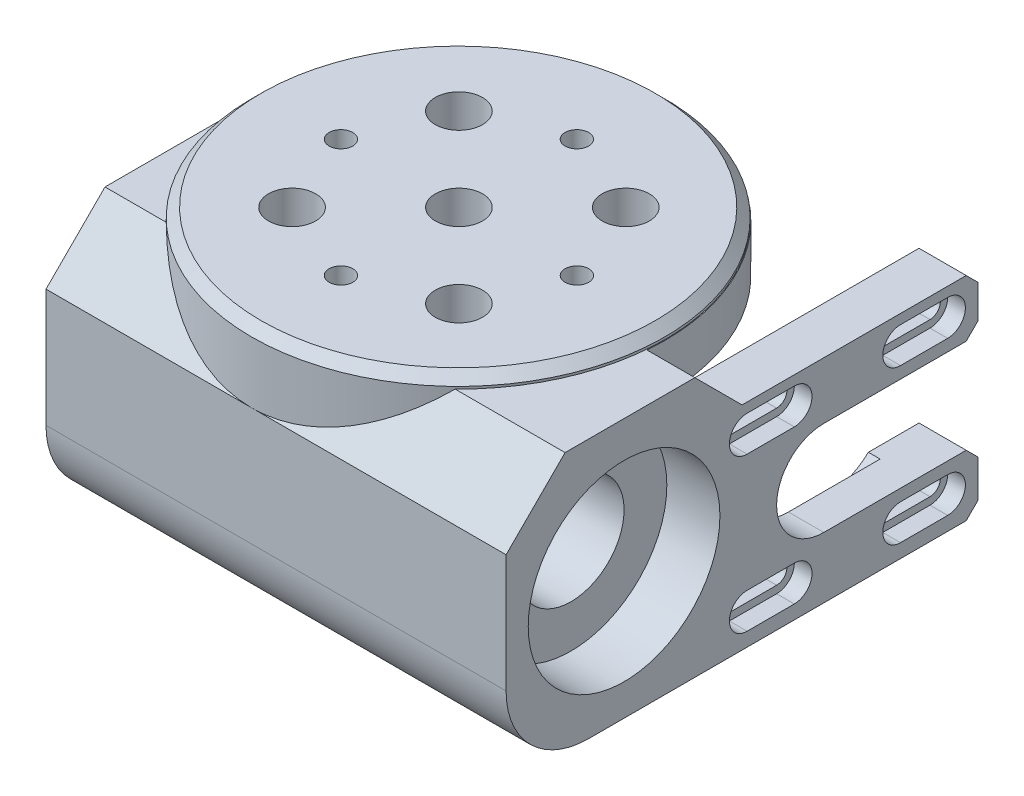
from build123d import *
from build123d.topology import SkipClean

# Parameters (mm, degrees)
SKETCH1_R           = 35.00000000000001
SKETCH1_R_2         = 4
BOSS_EXTRUDE1_DEPTH = 2
CHAMFER1_SIZE       = 1.6
BOSS_EXTRUDE2_START = 8
SKETCH2_R           = 4
BOSS_EXTRUDE2_DEPTH = 8
BOSS_EXTRUDE3_START = 36
SKETCH3_R           = 3.999999999999999
BOSS_EXTRUDE3_DEPTH = 36
BOSS_EXTRUDE4_DEPTH = 8
CUT_EXTRUDE1_DEPTH  = 8
SKETCH6_R           = 9
CUT_EXTRUDE2_DEPTH  = 101.22474744293447
SKETCH7_R           = 16.25
CUT_EXTRUDE3_DEPTH  = 9
CUT_EXTRUDE4_START  = -9
SKETCH8_R           = 16.25
CUT_EXTRUDE4_DEPTH  = 9
CHAMFER2_SIZE       = 10
FILLET1_R           = 14
FILLET2_R           = 14
CUT_EXTRUDE5_DEPTH  = 9
CUT_EXTRUDE6_DEPTH  = 9
CHAMFER3_SIZE       = 2
CUT_EXTRUDE7_START  = -3
CUT_EXTRUDE7_DEPTH  = 3
BOSS_EXTRUDE5_START = 36
BOSS_EXTRUDE5_DEPTH = 36
CHAMFER4_SIZE       = 23
CHAMFER4_SIZE2      = 35.41689416773558
SKETCH13_R          = 2.0000000000000004
CUT_EXTRUDE8_DEPTH  = 12
SKETCH14_R          = 4.000000000000001
SKETCH14_R_2        = 4.000000000000002
CUT_EXTRUDE9_DEPTH  = 7
CUT_EXTRUDE10_DEPTH = 15
SKETCH16_W          = 8
SKETCH16_H          = 8
BOSS_EXTRUDE6_DEPTH = 5
CHAMFER5_SIZE       = 8
CUT_EXTRUDE11_DEPTH = 2


with BuildPart() as part:
    # Sketch1 → Boss-Extrude1 (new body)
    with BuildSketch(Plane(origin=(0, 0, 0), x_dir=(1, 0, 0), z_dir=(0, 1, 0))):
        with Locations(Location((-0.12572339457591175, 0, 0), (0, 0, 270))):
            Circle(SKETCH1_R)
        with Locations(Location((0, 0, 0), (0, 0, 270))):
            Circle(SKETCH1_R_2, mode=Mode.SUBTRACT)
    extrude(amount=BOSS_EXTRUDE1_DEPTH)

    # Chamfer1
    chamfer1_edges = [part.edges().sort_by_distance(p)[0] for p in [
        (-0.12572339457590104, 2, -35.00000000000001),
    ]]
    chamfer(chamfer1_edges, length=CHAMFER1_SIZE)

    # Sketch2 → Boss-Extrude2 (add)
    with SkipClean():  # the faces are left unmerged after this step: merging them gives an invalid solid
        with BuildSketch(Plane.XZ.offset(BOSS_EXTRUDE2_START)):
            with BuildLine():
                Line((-35.00000000000001, 0), (-35.00000000000001, 35.00000000000001))
                Line((-35.00000000000001, 35.00000000000001), (35.00000000000001, 35.00000000000001))
                Line((35.00000000000001, 35.00000000000001), (35.00000000000001, 0))
                ThreePointArc((35.00000000000001, 0), (-6.43e-15, -35.00000000000001), (-35.00000000000001, 0))
            make_face()
            with Locations(Location((0, 0, 0), (0, 0, 270))):
                Circle(SKETCH2_R, mode=Mode.SUBTRACT)
        extrude(amount=-BOSS_EXTRUDE2_DEPTH)

    # Sketch3 → Boss-Extrude3 (add)
    with SkipClean():  # the faces are left unmerged after this step: merging them gives an invalid solid
        with BuildSketch(Plane.XZ.offset(8).offset(BOSS_EXTRUDE3_START)):
            with BuildLine():
                Line((-35.000000000000014, -2.4286e-13), (-35.000000000000014, 35))
                Line((-35.000000000000014, 35), (35.000000000000014, 35))
                Line((35.000000000000014, 35), (35.00000000000003, -44.999999999999986))
                Line((35.00000000000003, -44.999999999999986), (27.000000000000032, -44.999999999999986))
                Line((27.000000000000032, -44.999999999999986), (27.000000000000032, -2.9999999999999956))
                Line((27.000000000000032, -2.9999999999999956), (11.618950038622254, -2.9999999999999956))
                ThreePointArc((11.618950038622254, -2.9999999999999956), (1.0611830554466926, -11.952986677932541), (-10.908712114635716, -4.999999999999997))
                Line((-10.908712114635716, -4.999999999999997), (-34.64101615137756, -4.999999999999997))
                ThreePointArc((-34.64101615137756, -4.999999999999997), (-34.910138679889364, -2.5064351878501627), (-35.000000000000014, -2.4286e-13))
            make_face()
            with Locations(Location((0, 0, 0), (0, 0, 270))):
                Circle(SKETCH3_R, mode=Mode.SUBTRACT)
        extrude(amount=-BOSS_EXTRUDE3_DEPTH)

    # Sketch4 → Boss-Extrude4 (add)
    with SkipClean():  # the faces are left unmerged after this step: merging them gives an invalid solid
        with BuildSketch(Plane(origin=(35.00000000000001, 0, 0), x_dir=(0, 0, -1), z_dir=(1, 0, 0))):
            Polygon((0, 0), (-35.00000000000001, 0), (-35, -44), (44.999999999999986, -44), (44.999999999999986, -8), (0, -8), align=None)
        extrude(amount=BOSS_EXTRUDE4_DEPTH)

    # Sketch5 → Cut-Extrude1 (cut)
    with SkipClean():  # the faces are left unmerged after this step: merging them gives an invalid solid
        with BuildSketch(Plane.ZY.offset(-27.000000000000032)):
            Polygon((-2.9999999999999956, -8), (-22.271057451320065, -8), (-44.999999999999986, -8), (-44.999999999999986, -44), (-2.9999999999999956, -44), align=None)
        extrude(amount=-CUT_EXTRUDE1_DEPTH, mode=Mode.SUBTRACT)

    # Sketch6 → Cut-Extrude2 (cut, through all)
    with SkipClean():  # the faces are left unmerged after this step: merging them gives an invalid solid
        with BuildSketch(Plane.ZY.offset(35.00000000000001)):
            with Locations((15.000000000000004, -22.399999999999995)):
                Circle(SKETCH6_R)
        extrude(amount=-CUT_EXTRUDE2_DEPTH, mode=Mode.SUBTRACT)

    # Sketch7 → Cut-Extrude3 (cut)
    with SkipClean():  # the faces are left unmerged after this step: merging them gives an invalid solid
        with BuildSketch(Plane(origin=(43.00000000000001, 0, 0), x_dir=(0, 0, -1), z_dir=(1, 0, 0))):
            with Locations((-15.000000000000004, -22.399999999999995)):
                Circle(SKETCH7_R)
        extrude(amount=-CUT_EXTRUDE3_DEPTH, mode=Mode.SUBTRACT)

    # Sketch8 → Cut-Extrude4 (cut)
    with SkipClean():  # the faces are left unmerged after this step: merging them gives an invalid solid
        with BuildSketch(Plane.ZY.offset(35.00000000000001).offset(CUT_EXTRUDE4_START)):
            with Locations(Location((15.000000000000004, -22.399999999999995, 0), (0, 0, 180))):
                Circle(SKETCH8_R)
        extrude(amount=CUT_EXTRUDE4_DEPTH, mode=Mode.SUBTRACT)

    # Chamfer2
    # the kernel refuses this chamfer: 10 mm, written as the material it takes off along each edge
    with BuildSketch(Plane(origin=(-0.12572339457592108, 0, 35.00000000000001), x_dir=(0, 0.027495876610586372, -0.9996219169112968), z_dir=(1, 0, 0))) as chamfer2_piece_1_section:
        Polygon((CHAMFER2_SIZE * 0.999621916911, -CHAMFER2_SIZE * 0.0274958766106), (-CHAMFER2_SIZE * 0.0274958766106, -CHAMFER2_SIZE * 0.999621916911), (0, 0), align=None)
    chamfer2_piece_1 = extrude(amount=35.12572339457593, mode=Mode.PRIVATE)
    chamfer2_piece_1 = chamfer2_piece_1 - Plane(origin=(-0.12572339457591175, -3.623493545412481, 0), x_dir=(-1.8e-16, 0, 1), z_dir=(0, -1, 0)) * Cylinder(35.00000000000001, 111, mode=Mode.PRIVATE)
    add(chamfer2_piece_1, mode=Mode.SUBTRACT)
    with BuildSketch(Plane(origin=(-60.716829879659116, 0, 35.00000000000001), x_dir=(0, 0.027495876610586372, -0.9996219169112968), z_dir=(1, 0, 0))) as chamfer2_piece_2_section:
        Polygon((CHAMFER2_SIZE * 0.999621916911, -CHAMFER2_SIZE * 0.0274958766106), (-CHAMFER2_SIZE * 0.0274958766106, -CHAMFER2_SIZE * 0.999621916911), (0, 0), align=None)
    chamfer2_piece_2 = extrude(amount=60.591106485083195, mode=Mode.PRIVATE)
    chamfer2_piece_2 = chamfer2_piece_2 - Plane(origin=(-0.12572339457591175, -3.626934309923686, 0), x_dir=(-1.8e-16, 0, 1), z_dir=(0, -1, 0)) * Cylinder(35.00000000000001, 162, mode=Mode.PRIVATE)
    add(chamfer2_piece_2, mode=Mode.SUBTRACT)
    with BuildSketch(Plane(origin=(35.00000000000001, 0, 35.00000000000001), x_dir=(0, 0.027495876610586372, -0.9996219169112968), z_dir=(1, 0, 0))) as chamfer2_piece_3:
        Polygon((CHAMFER2_SIZE * 0.999621916911, -CHAMFER2_SIZE * 0.0274958766106), (-CHAMFER2_SIZE * 0.0274958766106, -CHAMFER2_SIZE * 0.999621916911), (0, 0), align=None)
    extrude(amount=33.71682987965911, mode=Mode.SUBTRACT)

    # Fillet1
    fillet1_edges = [part.edges().sort_by_distance(p)[0] for p in [
        (4, -44, 35),
        (-22.774864133006638, -44, -4.999999999999997),
    ]]
    fillet(fillet1_edges, radius=FILLET1_R)

    # Fillet2
    fillet2_edges = [part.edges().sort_by_distance(p)[0] for p in [
        (23.309475019311144, -44, -2.9999999999999956),
    ]]
    fillet(fillet2_edges, radius=FILLET2_R)

    # Sketch9 → Cut-Extrude5 (cut)
    with BuildSketch(Plane.ZY.offset(-35.00000000000003)):
        with BuildLine():
            Line((-44.999999999999986, -33.65486047203874), (-44.999999999999986, -17.65486047203874))
            Line((-44.999999999999986, -17.65486047203874), (-18.86034711023605, -17.654860472038735))
            ThreePointArc((-18.86034711023605, -17.654860472038735), (-10.860347110236049, -25.654860472038735), (-18.86034711023605, -33.654860472038735))
            Line((-18.86034711023605, -33.654860472038735), (-44.999999999999986, -33.65486047203874))
        make_face()
    extrude(amount=-CUT_EXTRUDE5_DEPTH, mode=Mode.SUBTRACT)

    # Sketch10 → Cut-Extrude6 (cut)
    with BuildSketch(Plane.ZY.offset(-35.00000000000003)):
        with BuildLine():
            Line((-39.86034711023605, -10.904860472038738), (-31.860347110236052, -10.904860472038736))
            ThreePointArc((-31.860347110236052, -10.904860472038736), (-30.110347110236052, -12.654860472038736), (-31.860347110236052, -14.404860472038736))
            Line((-31.860347110236052, -14.404860472038736), (-39.86034711023605, -14.404860472038738))
            ThreePointArc((-39.86034711023605, -14.404860472038738), (-41.61034711023605, -12.654860472038738), (-39.86034711023605, -10.904860472038738))
        make_face()
        with BuildLine():
            Line((-39.86034711023605, -36.90486047203874), (-31.860347110236038, -36.90486047203874))
            ThreePointArc((-31.860347110236038, -36.90486047203874), (-30.110347110236052, -38.65486047203874), (-31.860347110236038, -40.40486047203874))
            Line((-31.860347110236038, -40.40486047203874), (-39.86034711023605, -40.40486047203874))
            ThreePointArc((-39.86034711023605, -40.40486047203874), (-41.61034711023605, -38.65486047203874), (-39.86034711023605, -36.90486047203874))
        make_face()
        with BuildLine():
            Line((-13.86034711023605, -10.904860472038738), (-5.86034711023605, -10.904860472038736))
            ThreePointArc((-5.86034711023605, -10.904860472038736), (-4.110347110236053, -12.654860472038736), (-5.86034711023605, -14.404860472038736))
            Line((-5.86034711023605, -14.404860472038736), (-13.86034711023605, -14.404860472038738))
            ThreePointArc((-13.86034711023605, -14.404860472038738), (-15.610347110236054, -12.654860472038738), (-13.86034711023605, -10.904860472038738))
        make_face()
        with BuildLine():
            Line((-13.860347110236047, -36.904860472038735), (-5.860347110236046, -36.904860472038735))
            ThreePointArc((-5.860347110236046, -36.904860472038735), (-4.110347110236057, -38.65486047203874), (-5.860347110236046, -40.404860472038735))
            Line((-5.860347110236046, -40.404860472038735), (-13.860347110236047, -40.404860472038735))
            ThreePointArc((-13.860347110236047, -40.404860472038735), (-15.610347110236058, -38.65486047203874), (-13.860347110236047, -36.904860472038735))
        make_face()
    extrude(amount=-CUT_EXTRUDE6_DEPTH, mode=Mode.SUBTRACT)

    # Chamfer3
    chamfer3_edges = [part.edges().sort_by_distance(p)[0] for p in [
        (39.000000000000014, -17.65486047203874, -44.999999999999986),
        (39.000000000000014, -33.65486047203874, -44.999999999999986),
        (39.00000000000001, -8, -44.999999999999986),
        (39.00000000000001, -44, -44.999999999999986),
    ]]
    chamfer(chamfer3_edges, length=CHAMFER3_SIZE)

    # Sketch11 → Cut-Extrude7 (cut)
    # profile 1 of 4: a face of its own
    with BuildSketch(Plane(origin=(43.00000000000001, 0, 0), x_dir=(0, 0, -1), z_dir=(1, 0, 0)).offset(CUT_EXTRUDE7_START)):
        with BuildLine():
            Line((13.860347110236054, -15.654860472038738), (5.860347110236053, -15.654860472038738))
            ThreePointArc((5.860347110236053, -15.654860472038738), (2.8603471102360567, -12.654860472038736), (5.860347110236053, -9.65486047203874))
            Line((5.860347110236053, -9.65486047203874), (13.860347110236054, -9.65486047203874))
            ThreePointArc((13.860347110236054, -9.65486047203874), (16.860347110236056, -12.654860472038738), (13.860347110236054, -15.654860472038738))
        make_face()
        with BuildLine():
            Line((13.86034711023605, -10.904860472038738), (5.86034711023605, -10.904860472038736))
            ThreePointArc((5.86034711023605, -10.904860472038736), (4.110347110236053, -12.654860472038736), (5.8603471102360505, -14.404860472038736))
            Line((5.8603471102360505, -14.404860472038736), (13.86034711023605, -14.404860472038738))
            ThreePointArc((13.86034711023605, -14.404860472038738), (15.610347110236054, -12.654860472038738), (13.86034711023605, -10.904860472038738))
        make_face(mode=Mode.SUBTRACT)
    # profile 2 of 4: a face of its own
    with BuildSketch(Plane(origin=(43.00000000000001, 0, 0), x_dir=(0, 0, -1), z_dir=(1, 0, 0)).offset(CUT_EXTRUDE7_START)):
        with BuildLine():
            Line((39.86034711023605, -15.654860472038738), (31.860347110236052, -15.654860472038738))
            ThreePointArc((31.860347110236052, -15.654860472038738), (28.860347110236056, -12.654860472038736), (31.860347110236052, -9.65486047203874))
            Line((31.860347110236052, -9.65486047203874), (39.86034711023605, -9.65486047203874))
            ThreePointArc((39.86034711023605, -9.65486047203874), (42.86034711023605, -12.654860472038738), (39.86034711023605, -15.654860472038738))
        make_face()
        with BuildLine():
            Line((31.860347110236052, -14.404860472038736), (39.86034711023605, -14.404860472038738))
            ThreePointArc((39.86034711023605, -14.404860472038738), (41.61034711023605, -12.654860472038738), (39.86034711023605, -10.904860472038738))
            Line((39.86034711023605, -10.904860472038738), (31.860347110236052, -10.904860472038736))
            ThreePointArc((31.860347110236052, -10.904860472038736), (30.110347110236052, -12.654860472038736), (31.860347110236052, -14.404860472038736))
        make_face(mode=Mode.SUBTRACT)
    # profile 3 of 4: a face of its own
    with BuildSketch(Plane(origin=(43.00000000000001, 0, 0), x_dir=(0, 0, -1), z_dir=(1, 0, 0)).offset(CUT_EXTRUDE7_START)):
        with BuildLine():
            Line((13.86034711023605, -41.65486047203874), (5.86034711023605, -41.65486047203874))
            ThreePointArc((5.86034711023605, -41.65486047203874), (2.8603471102360425, -38.65486047203874), (5.86034711023605, -35.654860472038735))
            Line((5.86034711023605, -35.654860472038735), (13.86034711023605, -35.654860472038735))
            ThreePointArc((13.86034711023605, -35.654860472038735), (16.86034711023605, -38.65486047203874), (13.86034711023605, -41.65486047203874))
        make_face()
        with BuildLine():
            Line((5.860347110236047, -40.404860472038735), (13.860347110236047, -40.404860472038735))
            ThreePointArc((13.860347110236047, -40.404860472038735), (15.610347110236043, -38.65486047203874), (13.860347110236047, -36.904860472038735))
            Line((13.860347110236047, -36.904860472038735), (5.860347110236046, -36.904860472038735))
            ThreePointArc((5.860347110236046, -36.904860472038735), (4.1103471102360425, -38.65486047203874), (5.860347110236047, -40.404860472038735))
        make_face(mode=Mode.SUBTRACT)
    # profile 4 of 4: a face of its own
    with BuildSketch(Plane(origin=(43.00000000000001, 0, 0), x_dir=(0, 0, -1), z_dir=(1, 0, 0)).offset(CUT_EXTRUDE7_START)):
        with BuildLine():
            Line((31.860347110236052, -35.654860472038735), (39.86034711023605, -35.654860472038735))
            ThreePointArc((39.86034711023605, -35.654860472038735), (42.86034711023605, -38.65486047203874), (39.86034711023605, -41.65486047203874))
            Line((39.86034711023605, -41.65486047203874), (31.860347110236052, -41.65486047203874))
            ThreePointArc((31.860347110236052, -41.65486047203874), (28.860347110236045, -38.65486047203874), (31.860347110236052, -35.654860472038735))
        make_face()
        with BuildLine():
            Line((39.86034711023605, -36.90486047203874), (31.860347110236038, -36.90486047203874))
            ThreePointArc((31.860347110236038, -36.90486047203874), (30.110347110236052, -38.65486047203874), (31.860347110236038, -40.40486047203874))
            Line((31.860347110236038, -40.40486047203874), (39.86034711023605, -40.40486047203874))
            ThreePointArc((39.86034711023605, -40.40486047203874), (41.61034711023605, -38.65486047203874), (39.86034711023605, -36.90486047203874))
        make_face(mode=Mode.SUBTRACT)
    extrude(amount=CUT_EXTRUDE7_DEPTH, mode=Mode.SUBTRACT)

    # Sketch12 → Boss-Extrude5 (add)
    with BuildSketch(Plane.XZ.offset(8).offset(BOSS_EXTRUDE5_START)):
        with BuildLine():
            Line((-3, -11.618950038622252), (-3, -34.8711915483254))
            ThreePointArc((-3, -34.8711915483254), (2.14e-15, -35.00000000000001), (3, -34.8711915483254))
            Line((3, -34.8711915483254), (3, -11.618950038622252))
            ThreePointArc((3, -11.618950038622252), (7.3e-16, -12.000000000000002), (-3, -11.618950038622252))
        make_face()
    extrude(amount=-BOSS_EXTRUDE5_DEPTH)

    # Chamfer4
    chamfer4_edges = [part.edges().sort_by_distance(p)[0] for p in [
        (4.4e-16, -44, -35),
    ]]
    chamfer4_side = [part.faces().sort_by_distance(p)[0] for p in [
        (10.41921121396124, -44, 1.5648503283052186),
    ]]
    chamfer(chamfer4_edges, length=CHAMFER4_SIZE, length2=CHAMFER4_SIZE2, reference=chamfer4_side[0])

    # Sketch13 → Cut-Extrude8 (cut)
    with BuildSketch(Plane(origin=(0, 2, 0), x_dir=(1, 0, 0), z_dir=(0, 1, 0))):
        with Locations(Location((0, 20, 0), (0, 0, 270))):
            Circle(SKETCH13_R)
        with Locations(Location((20, -6.983e-14, 0), (0, 0, 270))):
            Circle(SKETCH13_R)
        with Locations(Location((-1.3966e-13, -20, 0), (0, 0, 270))):
            Circle(SKETCH13_R)
        with Locations(Location((-19.999999999999996, 2.0949e-13, 0), (0, 0, 270))):
            Circle(SKETCH13_R)
    extrude(amount=-CUT_EXTRUDE8_DEPTH, mode=Mode.SUBTRACT)

    # Sketch14 → Cut-Extrude9 (cut)
    with BuildSketch(Plane(origin=(0, 2, 0), x_dir=(1, 0, 0), z_dir=(0, 1, 0))):
        with Locations(Location((14.142135623730923, 14.142135623730976, 0), (0, 0, 270))):
            Circle(SKETCH14_R)
        with Locations(Location((14.142135623730928, -14.14213562373097, 0), (0, 0, 270))):
            Circle(SKETCH14_R_2)
        with Locations(Location((-14.142135623731019, -14.142135623730875, 0), (0, 0, 270))):
            Circle(SKETCH14_R)
        with Locations(Location((-14.14213562373083, 14.14213562373107, 0), (0, 0, 270))):
            Circle(SKETCH14_R)
    extrude(amount=-CUT_EXTRUDE9_DEPTH, mode=Mode.SUBTRACT)

    # Sketch15 → Cut-Extrude10 (cut)
    with SkipClean():  # the faces are left unmerged after this step: merging them gives an invalid solid
        with BuildSketch(Plane.XZ.offset(44)):
            Polygon((-1.73e-15, 7.505553499465134), (-6.499999999999999, 3.752776749732567), (-6.499999999999997, -3.752776749732569), (1.07e-15, -7.505553499465135), (6.500000000000001, -3.7527767497325675), (6.499999999999998, 3.7527767497325697), align=None)
        extrude(amount=-CUT_EXTRUDE10_DEPTH, mode=Mode.SUBTRACT)

    # Sketch16 → Boss-Extrude6 (add)
    with SkipClean():  # the faces are left unmerged after this step: merging them gives an invalid solid
        with BuildSketch(Plane(origin=(0, 0, 0), x_dir=(-1, 0, 0), z_dir=(0, 0, -1))):
            with Locations((-39.00000000000001, -4)):
                Rectangle(SKETCH16_W, SKETCH16_H)
        extrude(amount=BOSS_EXTRUDE6_DEPTH)

    # Chamfer5
    # the kernel refuses this chamfer: 8 mm, written as the material it takes off along each edge
    with BuildSketch(Plane(origin=(14.42653609627272, 0, -5), x_dir=(0, 0.027495876610586365, 0.9996219169112968), z_dir=(1, 0, 0))) as chamfer5_piece_1_section:
        Polygon((CHAMFER5_SIZE * 0.999621916911, CHAMFER5_SIZE * 0.0274958766106), (-CHAMFER5_SIZE * 0.0274958766106, CHAMFER5_SIZE * 0.999621916911), (0, 0), align=None)
    chamfer5_piece_1 = extrude(amount=49.146927807454574, mode=Mode.PRIVATE)
    chamfer5_piece_1 = chamfer5_piece_1 - Plane(origin=(1.78e-15, -0.5998737584279192, 0), x_dir=(1, 0, 0), z_dir=(0, -1, 0)) * Cylinder(35.00000000000001, 131, mode=Mode.PRIVATE)
    add(chamfer5_piece_1, mode=Mode.SUBTRACT)

    # Sketch17 → Cut-Extrude11 (cut)
    with BuildSketch(Plane.ZY.offset(-35.00000000000003)):
        with BuildLine():
            Line((-26.860347110236045, -14.654860472038743), (-18.860347110236045, -14.654860472038743))
            ThreePointArc((-18.860347110236045, -14.654860472038743), (-7.8603471102360345, -25.654860472038738), (-18.860347110236045, -36.65486047203875))
            Line((-18.860347110236045, -36.65486047203875), (-26.86034711023604, -36.65486047203875))
            ThreePointArc((-26.86034711023604, -36.65486047203875), (-37.86034711023604, -25.654860472038738), (-26.860347110236045, -14.654860472038743))
        make_face()
    extrude(amount=-CUT_EXTRUDE11_DEPTH, mode=Mode.SUBTRACT)


solid = part.part
